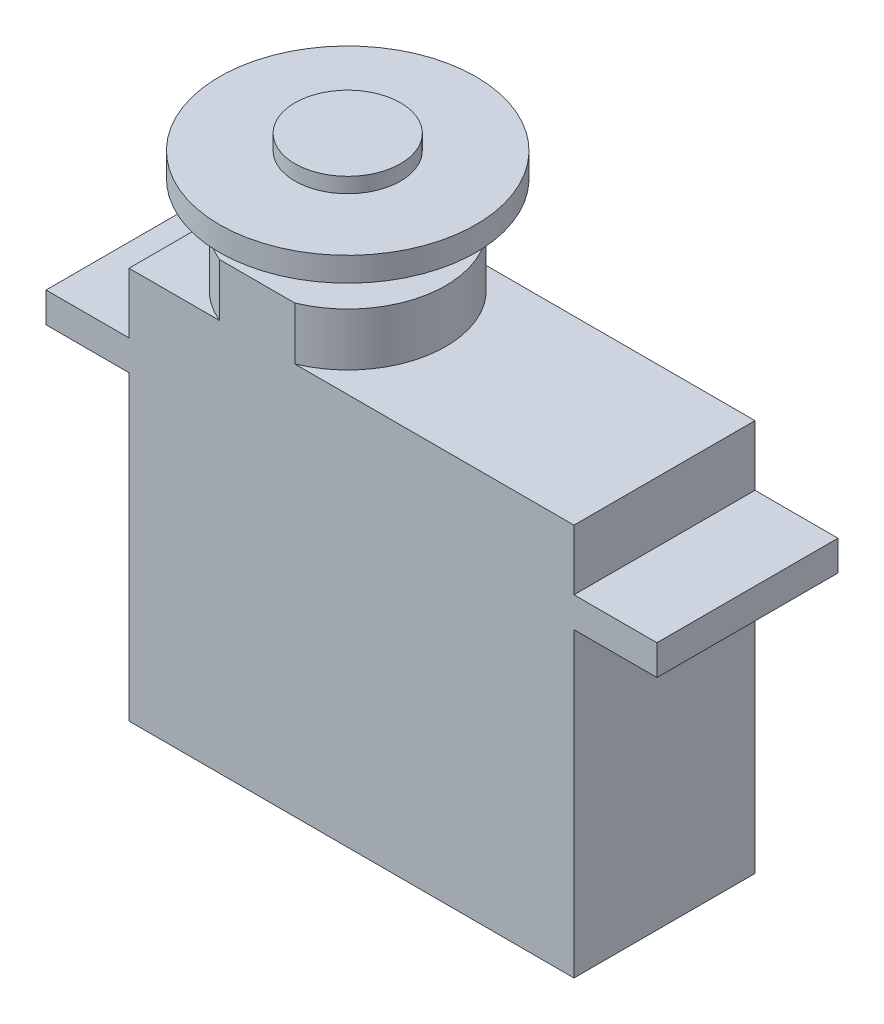
from build123d import *

# Parameters (mm, degrees)
VYSUNOUT1_DEPTH          = 6
ODEBRAT_START            = -29.5
ODEBRAT_VYSUNUT_M2_DEPTH = 3.5


# Read off the part's stored shape, not the designer's step: Odebrat vysunutím2
with BuildPart() as part:
    # Skica1 → Vysunout1 (new, symmetric)
    with BuildSketch(Plane.XY):
        Polygon((-8.5, 0), (21, 0), (21, 20), (26.5, 20), (26.5, 22), (21, 22), (21, 26), (-8.5, 26), (-8.5, 22), (-14, 22), (-14, 20), (-8.5, 20), align=None)
    extrude(amount=VYSUNOUT1_DEPTH, both=True)

    # Skica2 → Rotovat1 (revolve)
    with BuildSketch(Plane.XY, mode=Mode.PRIVATE) as rotovat1_sk:
        Polygon((-6.5, 26), (-6.5, 29.5), (-4, 29.5), (-4, 32.4), (-8.5, 32.4), (-8.5, 34), (-3.5, 34), (-3.5, 35), (0, 35), (0, 26), align=None)
    revolve(rotovat1_sk.sketch.rotate(Axis((0, 0, 0), (0, 1, 0)), 270), axis=Axis((0, 0, 0), (0, 1, 0)))

    # Odebrat vysunutím2 outline → Odebrat vysunutím2 (cut)
    with BuildSketch(Plane.XZ.offset(ODEBRAT_START)):
        with BuildLine():
            Line((-2.5, 6), (2.5, 6))
            ThreePointArc((2.5, 6), (0, 6.5), (-2.5, 6))
        make_face()
        with BuildLine():
            Line((2.5, -6), (-2.5, -6))
            ThreePointArc((-2.5, -6), (0, -6.5), (2.5, -6))
        make_face()
    extrude(amount=ODEBRAT_VYSUNUT_M2_DEPTH, mode=Mode.SUBTRACT)


solid = part.part
